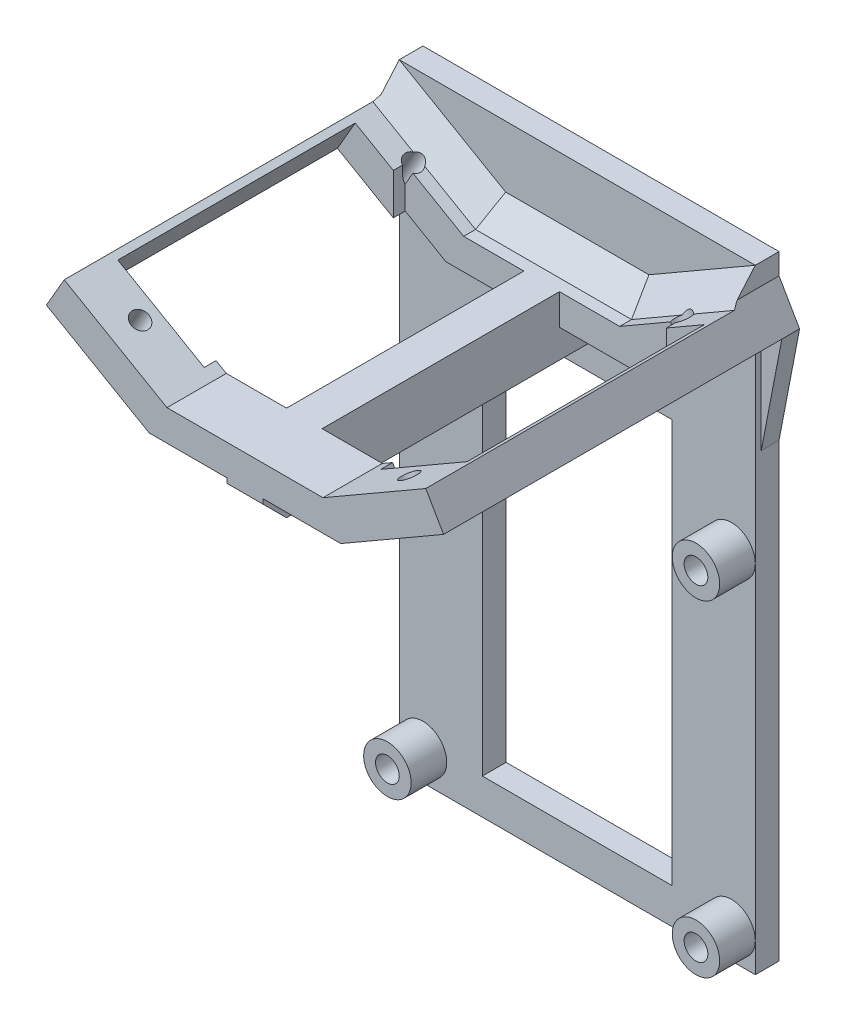
from build123d import *

# Parameters (mm, degrees)
EXTRUDE_1_DEPTH      = 2
EXTRUDE_2_DEPTH      = 28
EXTRUDE_2_DEPTH_BACK = 2
CUT_EXTRUDE_5_REACH  = 61.651
SKETCH_3_R           = 0.75
SKETCH_3_W           = 9
SKETCH_3_H           = 20
CUT_EXTRUDE_7_REACH  = 62.685
SKETCH_12_R          = 0.75
SKETCH_12_W          = 9
SKETCH_12_H          = 20
CUT_EXTRUDE_8_REACH  = 74.725
SKETCH_13_R          = 1
SKETCH_13_W          = 16
SKETCH_13_H          = 34
CHAMFER_5_SIZE       = 2
SKETCH_14_W          = 3
SKETCH_14_H          = 5
EXTRUDE_8_DEPTH      = 28
CHAMFER_6_SIZE       = 2
EXTRUDE_START        = 3
SKETCH_15_R          = 2
SKETCH_15_R_2        = 1
EXTRUDE_9_DEPTH      = 3
CUT_EXTRUDE_9_REACH  = 56.258
SKETCH_16_W          = 10
SKETCH_16_H          = 20
EXTRUDE_10_DEPTH     = 24
EXTRUDE_11_DEPTH     = 1.5
CUT_EXTRUDE_10_REACH = 74.725
SKETCH_19_W          = 30
SKETCH_19_H          = 13.226497308


with BuildPart() as part:
    # 草圖1 → 填料-伸長1 (new body)
    with BuildSketch(Plane.XY):
        Polygon((-15, 0), (15, 0), (15, -15), (16.732050808, -18), (15, -19), (15, -65), (-15, -65), (-15, -19), (-16.732050808, -18), (-15, -15), align=None)
    extrude(amount=EXTRUDE_1_DEPTH)

    # 草圖2 → 填料-伸長2 (add, two sides: drawn at the far end of the back side and taken through both)
    with BuildSketch(Plane.XY.offset(2).offset(-EXTRUDE_2_DEPTH_BACK)):
        Polygon((-16.732050808, -18), (-8.07179677, -23), (8.07179677, -23), (16.732050808, -18), (15.232050808, -15.401923789), (6.57179677, -20.401923789), (-6.57179677, -20.401923789), (-15.232050808, -15.401923789), align=None)
    extrude(amount=EXTRUDE_2_DEPTH + EXTRUDE_2_DEPTH_BACK)

    # 草圖3 → 除料-伸長5 (cut, up to next)
    with BuildSketch(Plane(origin=(10.813121216, -21.417295593, 0), x_dir=(0.8660254037844397, 0.49999999999999806, 0), z_dir=(-0.49999999999999806, 0.8660254037844397, 0)), mode=Mode.PRIVATE) as cut_extrude_5_sk1:
        with Locations(Location((2.334591186, -4.5, 0), (0, 0, 180))):
            Circle(SKETCH_3_R)
    cut_extrude_5_tool1 = extrude(cut_extrude_5_sk1.sketch, amount=CUT_EXTRUDE_5_REACH, mode=Mode.PRIVATE) & part.part
    # 草圖3 → 除料-伸長5 (cut, up to next)
    with BuildSketch(Plane(origin=(10.813121216, -21.417295593, 0), x_dir=(0.8660254037844397, 0.49999999999999806, 0), z_dir=(-0.49999999999999806, 0.8660254037844397, 0)), mode=Mode.PRIVATE) as cut_extrude_5_sk2:
        with Locations(Location((2.334591186, -27.5, 0), (0, 0, 180))):
            Circle(SKETCH_3_R)
    cut_extrude_5_tool2 = extrude(cut_extrude_5_sk2.sketch, amount=CUT_EXTRUDE_5_REACH, mode=Mode.PRIVATE) & part.part
    # 草圖3 → 除料-伸長5 (cut, up to next)
    with BuildSketch(Plane(origin=(10.813121216, -21.417295593, 0), x_dir=(0.8660254037844397, 0.49999999999999806, 0), z_dir=(-0.49999999999999806, 0.8660254037844397, 0)), mode=Mode.PRIVATE) as cut_extrude_5_sk3:
        with Locations((2.334591186, -16)):
            Rectangle(SKETCH_3_W, SKETCH_3_H)
    cut_extrude_5_tool3 = extrude(cut_extrude_5_sk3.sketch, amount=CUT_EXTRUDE_5_REACH, mode=Mode.PRIVATE) & part.part
    add(cut_extrude_5_tool1.solids().sort_by_distance((12.834936, -20.25, 4.5))[0], mode=Mode.SUBTRACT)
    add(cut_extrude_5_tool2.solids().sort_by_distance((12.834936, -20.25, 27.5))[0], mode=Mode.SUBTRACT)
    add(cut_extrude_5_tool3.solids().sort_by_distance((12.834936, -20.25, 16))[0], mode=Mode.SUBTRACT)

    # 草圖12 → 除料-伸長7 (cut, up to next)
    with BuildSketch(Plane(origin=(-11.977241336, -20.745190528, 0), x_dir=(0.8660254037844368, -0.5000000000000032, 0), z_dir=(-0.5000000000000032, -0.8660254037844369, 0)), mode=Mode.PRIVATE) as cut_extrude_7_sk1:
        with Locations((-0.990381057, 27.5)):
            Circle(SKETCH_12_R)
    cut_extrude_7_tool1 = extrude(cut_extrude_7_sk1.sketch, amount=-CUT_EXTRUDE_7_REACH, mode=Mode.PRIVATE) & part.part
    # 草圖12 → 除料-伸長7 (cut, up to next)
    with BuildSketch(Plane(origin=(-11.977241336, -20.745190528, 0), x_dir=(0.8660254037844368, -0.5000000000000032, 0), z_dir=(-0.5000000000000032, -0.8660254037844369, 0)), mode=Mode.PRIVATE) as cut_extrude_7_sk2:
        with Locations((-0.990381057, 4.5)):
            Circle(SKETCH_12_R)
    cut_extrude_7_tool2 = extrude(cut_extrude_7_sk2.sketch, amount=-CUT_EXTRUDE_7_REACH, mode=Mode.PRIVATE) & part.part
    # 草圖12 → 除料-伸長7 (cut, up to next)
    with BuildSketch(Plane(origin=(-11.977241336, -20.745190528, 0), x_dir=(0.8660254037844368, -0.5000000000000032, 0), z_dir=(-0.5000000000000032, -0.8660254037844369, 0)), mode=Mode.PRIVATE) as cut_extrude_7_sk3:
        with Locations((-0.990381057, 16)):
            Rectangle(SKETCH_12_W, SKETCH_12_H)
    cut_extrude_7_tool3 = extrude(cut_extrude_7_sk3.sketch, amount=-CUT_EXTRUDE_7_REACH, mode=Mode.PRIVATE) & part.part
    add(cut_extrude_7_tool1.solids().sort_by_distance((-12.834936, -20.25, 27.5))[0], mode=Mode.SUBTRACT)
    add(cut_extrude_7_tool2.solids().sort_by_distance((-12.834936, -20.25, 4.5))[0], mode=Mode.SUBTRACT)
    add(cut_extrude_7_tool3.solids().sort_by_distance((-12.834936, -20.25, 16))[0], mode=Mode.SUBTRACT)

    # 草圖13 → 除料-伸長8 (cut, up to next)
    with BuildSketch(Plane.XY.offset(2), mode=Mode.PRIVATE) as cut_extrude_8_sk1:
        with Locations((-13, -35)):
            Circle(SKETCH_13_R)
    cut_extrude_8_tool1 = extrude(cut_extrude_8_sk1.sketch, amount=-CUT_EXTRUDE_8_REACH, mode=Mode.PRIVATE) & part.part
    # 草圖13 → 除料-伸長8 (cut, up to next)
    with BuildSketch(Plane.XY.offset(2), mode=Mode.PRIVATE) as cut_extrude_8_sk2:
        with Locations((13, -35)):
            Circle(SKETCH_13_R)
    cut_extrude_8_tool2 = extrude(cut_extrude_8_sk2.sketch, amount=-CUT_EXTRUDE_8_REACH, mode=Mode.PRIVATE) & part.part
    # 草圖13 → 除料-伸長8 (cut, up to next)
    with BuildSketch(Plane.XY.offset(2), mode=Mode.PRIVATE) as cut_extrude_8_sk3:
        with Locations((-13, -62.5)):
            Circle(SKETCH_13_R)
    cut_extrude_8_tool3 = extrude(cut_extrude_8_sk3.sketch, amount=-CUT_EXTRUDE_8_REACH, mode=Mode.PRIVATE) & part.part
    # 草圖13 → 除料-伸長8 (cut, up to next)
    with BuildSketch(Plane.XY.offset(2), mode=Mode.PRIVATE) as cut_extrude_8_sk4:
        with Locations((13, -62.5)):
            Circle(SKETCH_13_R)
    cut_extrude_8_tool4 = extrude(cut_extrude_8_sk4.sketch, amount=-CUT_EXTRUDE_8_REACH, mode=Mode.PRIVATE) & part.part
    # 草圖13 → 除料-伸長8 (cut, up to next)
    with BuildSketch(Plane.XY.offset(2), mode=Mode.PRIVATE) as cut_extrude_8_sk5:
        with Locations((0, -45)):
            Rectangle(SKETCH_13_W, SKETCH_13_H)
    cut_extrude_8_tool5 = extrude(cut_extrude_8_sk5.sketch, amount=-CUT_EXTRUDE_8_REACH, mode=Mode.PRIVATE) & part.part
    add(cut_extrude_8_tool1.solids().sort_by_distance((-13, -35, 2))[0], mode=Mode.SUBTRACT)
    add(cut_extrude_8_tool2.solids().sort_by_distance((13, -35, 2))[0], mode=Mode.SUBTRACT)
    add(cut_extrude_8_tool3.solids().sort_by_distance((-13, -62.5, 2))[0], mode=Mode.SUBTRACT)
    add(cut_extrude_8_tool4.solids().sort_by_distance((13, -62.5, 2))[0], mode=Mode.SUBTRACT)
    add(cut_extrude_8_tool5.solids().sort_by_distance((0, -45, 2))[0], mode=Mode.SUBTRACT)

    # 導角5
    # the kernel refuses this chamfer: 2 mm, written as the material it adds along each edge
    with BuildSketch(Plane(origin=(15.232050808, -15.401923789, 2), x_dir=(-0.4998109584556485, 0.8656979742248804, -0.027495876610586403), z_dir=(-0.8660254037844387, -0.5000000000000001, 0))) as chamfer_5_piece_1_section:
        Polygon((CHAMFER_5_SIZE * 0.999621916911, -CHAMFER_5_SIZE * 0.0274958766106), (-CHAMFER_5_SIZE * 0.0274958766106, -CHAMFER_5_SIZE * 0.999621916911), (0, 0), align=None)
    chamfer_5_piece_1 = extrude(amount=15.143365976, mode=Mode.PRIVATE)
    chamfer_5_piece_1 = split(chamfer_5_piece_1, bisect_by=Plane(origin=(15, -15.354369678, 2.967720973), z_dir=(1, 0, 0)), keep=Keep.TOP, mode=Mode.PRIVATE)
    add(chamfer_5_piece_1)
    with BuildSketch(Plane(origin=(19.686336404, -12.830240801, 2), x_dir=(-0.4998109584556485, 0.8656979742248805, -0.027495876610586424), z_dir=(-0.8660254037844387, -0.5000000000000001, 0))) as chamfer_5_piece_2_section:
        Polygon((CHAMFER_5_SIZE * 0.999621916911, -CHAMFER_5_SIZE * 0.0274958766106), (-CHAMFER_5_SIZE * 0.0274958766106, -CHAMFER_5_SIZE * 0.999621916911), (0, 0), align=None)
    chamfer_5_piece_2 = extrude(amount=20.286731952, mode=Mode.PRIVATE)
    chamfer_5_piece_2 = split(chamfer_5_piece_2, bisect_by=Plane(origin=(15, -14.178978025, 2.335634482), z_dir=(-1, 0, 0)), keep=Keep.TOP, mode=Mode.PRIVATE)
    chamfer_5_piece_2 = split(chamfer_5_piece_2, bisect_by=Plane(origin=(14.593699493, -14.296266878, 2.335634482), z_dir=(0.8660254037844362, 0.5000000000000043, 0)), keep=Keep.TOP, mode=Mode.PRIVATE)
    add(chamfer_5_piece_2)
    with BuildSketch(Plane(origin=(15.232050808, -15.401923789, 2), x_dir=(-0.4998109584556485, 0.8656979742248804, -0.027495876610586403), z_dir=(-0.8660254037844387, -0.5000000000000001, 0))) as chamfer_5_piece_3_section:
        Polygon((CHAMFER_5_SIZE * 0.999621916911, -CHAMFER_5_SIZE * 0.0274958766106), (-CHAMFER_5_SIZE * 0.0274958766106, -CHAMFER_5_SIZE * 0.999621916911), (0, 0), align=None)
    chamfer_5_piece_3 = extrude(amount=15.143365976, mode=Mode.PRIVATE)
    chamfer_5_piece_3 = split(chamfer_5_piece_3, bisect_by=Plane(origin=(15, -17.612583445, 2.634430094), z_dir=(-1, 0, 0)), keep=Keep.TOP, mode=Mode.PRIVATE)
    chamfer_5_piece_3 = split(chamfer_5_piece_3, bisect_by=Plane(origin=(9.995642462, -20.401923789, 2.634430094), z_dir=(0, 1, 0)), keep=Keep.TOP, mode=Mode.PRIVATE)
    chamfer_5_piece_3 = chamfer_5_piece_3 - Plane(origin=(10.983078115, -17.042487205, 4.5), x_dir=(-0.8660254037844397, -0.49999999999999806, 0), z_dir=(0.49999999999999806, -0.8660254037844397, 0)) * Cylinder(0.75, 39, mode=Mode.PRIVATE)
    add(chamfer_5_piece_3)
    with BuildSketch(Plane(origin=(15.232050808, -15.401923789, 2), x_dir=(-0.4998109584556485, 0.8656979742248804, -0.027495876610586403), z_dir=(-0.8660254037844387, -0.5000000000000001, 0))) as chamfer_5_piece_4_section:
        Polygon((CHAMFER_5_SIZE * 0.999621916911, -CHAMFER_5_SIZE * 0.0274958766106), (-CHAMFER_5_SIZE * 0.0274958766106, -CHAMFER_5_SIZE * 0.999621916911), (0, 0), align=None)
    chamfer_5_piece_4 = extrude(amount=15.143365976, mode=Mode.PRIVATE)
    chamfer_5_piece_4 = split(chamfer_5_piece_4, bisect_by=Plane(origin=(3.657625077, -20.401923789, 2.718374554), z_dir=(0, -1, 0)), keep=Keep.TOP, mode=Mode.PRIVATE)
    add(chamfer_5_piece_4)
    with BuildSketch(Plane(origin=(11.715162746, -20.401923789, 2), x_dir=(0, 0.9996219169112968, -0.027495876610586403), z_dir=(-1, 0, 0))) as chamfer_5_piece_5:
        Polygon((CHAMFER_5_SIZE * 0.999621916911, -CHAMFER_5_SIZE * 0.0274958766106), (-CHAMFER_5_SIZE * 0.0274958766106, -CHAMFER_5_SIZE * 0.999621916911), (0, 0), align=None)
    extrude(amount=23.430325491)
    with BuildSketch(Plane(origin=(-2.117511174, -22.973606777, 2), x_dir=(0.4998109584556478, 0.8656979742248807, -0.027495876610586365), z_dir=(-0.866025403784439, 0.4999999999999994, 0))) as chamfer_5_piece_6_section:
        Polygon((CHAMFER_5_SIZE * 0.999621916911, -CHAMFER_5_SIZE * 0.0274958766106), (-CHAMFER_5_SIZE * 0.0274958766106, -CHAMFER_5_SIZE * 0.999621916911), (0, 0), align=None)
    chamfer_5_piece_6 = extrude(amount=15.143365976, mode=Mode.PRIVATE)
    chamfer_5_piece_6 = split(chamfer_5_piece_6, bisect_by=Plane(origin=(-3.657625077, -20.401923789, 2.718374554), z_dir=(0, -1, 0)), keep=Keep.TOP, mode=Mode.PRIVATE)
    add(chamfer_5_piece_6)
    with BuildSketch(Plane(origin=(-2.117511174, -22.973606777, 2), x_dir=(0.4998109584556478, 0.8656979742248807, -0.027495876610586365), z_dir=(-0.866025403784439, 0.4999999999999994, 0))) as chamfer_5_piece_7_section:
        Polygon((CHAMFER_5_SIZE * 0.999621916911, -CHAMFER_5_SIZE * 0.0274958766106), (-CHAMFER_5_SIZE * 0.0274958766106, -CHAMFER_5_SIZE * 0.999621916911), (0, 0), align=None)
    chamfer_5_piece_7 = extrude(amount=15.143365976, mode=Mode.PRIVATE)
    chamfer_5_piece_7 = split(chamfer_5_piece_7, bisect_by=Plane(origin=(-15, -17.612583445, 2.634430094), z_dir=(1, 0, 0)), keep=Keep.TOP, mode=Mode.PRIVATE)
    chamfer_5_piece_7 = split(chamfer_5_piece_7, bisect_by=Plane(origin=(-9.995642462, -20.401923789, 2.634430094), z_dir=(0, 1, 0)), keep=Keep.TOP, mode=Mode.PRIVATE)
    chamfer_5_piece_7 = chamfer_5_piece_7 - Plane(origin=(-10.983078115, -17.042487205, 4.5), x_dir=(0.8660254037844369, -0.5000000000000032, 0), z_dir=(-0.5000000000000032, -0.8660254037844369, 0)) * Cylinder(0.75, 39, mode=Mode.PRIVATE)
    add(chamfer_5_piece_7)
    with BuildSketch(Plane(origin=(-2.117511174, -22.973606777, 2), x_dir=(0.4998109584556478, 0.8656979742248807, -0.027495876610586365), z_dir=(-0.866025403784439, 0.4999999999999994, 0))) as chamfer_5_piece_8_section:
        Polygon((CHAMFER_5_SIZE * 0.999621916911, -CHAMFER_5_SIZE * 0.0274958766106), (-CHAMFER_5_SIZE * 0.0274958766106, -CHAMFER_5_SIZE * 0.999621916911), (0, 0), align=None)
    chamfer_5_piece_8 = extrude(amount=15.143365976, mode=Mode.PRIVATE)
    chamfer_5_piece_8 = split(chamfer_5_piece_8, bisect_by=Plane(origin=(-15, -15.354369678, 2.967720973), z_dir=(-1, 0, 0)), keep=Keep.TOP, mode=Mode.PRIVATE)
    add(chamfer_5_piece_8)
    with BuildSketch(Plane(origin=(-2.117511174, -22.973606777, 2), x_dir=(0.4998109584556478, 0.8656979742248807, -0.027495876610586365), z_dir=(-0.866025403784439, 0.4999999999999994, 0))) as chamfer_5_piece_9_section:
        Polygon((CHAMFER_5_SIZE * 0.999621916911, -CHAMFER_5_SIZE * 0.0274958766106), (-CHAMFER_5_SIZE * 0.0274958766106, -CHAMFER_5_SIZE * 0.999621916911), (0, 0), align=None)
    chamfer_5_piece_9 = extrude(amount=20.286731952, mode=Mode.PRIVATE)
    chamfer_5_piece_9 = split(chamfer_5_piece_9, bisect_by=Plane(origin=(-15, -14.178978025, 2.335634482), z_dir=(1, 0, 0)), keep=Keep.TOP, mode=Mode.PRIVATE)
    chamfer_5_piece_9 = split(chamfer_5_piece_9, bisect_by=Plane(origin=(-14.593699493, -14.296266878, 2.335634482), z_dir=(-0.8660254037844384, 0.5000000000000004, 0)), keep=Keep.TOP, mode=Mode.PRIVATE)
    add(chamfer_5_piece_9)

    # 草圖14 → 填料-伸長8 (add)
    with BuildSketch(Plane.XY.offset(30)):
        with Locations((0, -22.901923789)):
            Rectangle(SKETCH_14_W, SKETCH_14_H)
    extrude(amount=-EXTRUDE_8_DEPTH)

    # 導角6
    chamfer_6_edges = [part.edges().sort_by_distance(p)[0] for p in [
        (0, -25.401923789, 30),
    ]]
    chamfer(chamfer_6_edges, length=CHAMFER_6_SIZE)

    # 草圖15 → 填料-伸長9 (add)
    # profile 1 of 4: a face of its own
    with BuildSketch(Plane.XY.offset(2).offset(EXTRUDE_START)):
        with Locations(Location((-13, -35, 0), (0, 0, 180))):
            Circle(SKETCH_15_R)
        with Locations((-13, -35)):
            Circle(SKETCH_15_R_2, mode=Mode.SUBTRACT)
    # profile 2 of 4: a face of its own
    with BuildSketch(Plane.XY.offset(2).offset(EXTRUDE_START)):
        with Locations((13, -35)):
            Circle(SKETCH_15_R)
        with Locations((13, -35)):
            Circle(SKETCH_15_R_2, mode=Mode.SUBTRACT)
    # profile 3 of 4: a face of its own
    with BuildSketch(Plane.XY.offset(2).offset(EXTRUDE_START)):
        with Locations((13, -62.5)):
            Circle(SKETCH_15_R)
        with Locations((13, -62.5)):
            Circle(SKETCH_15_R_2, mode=Mode.SUBTRACT)
    # profile 4 of 4: a face of its own
    with BuildSketch(Plane.XY.offset(2).offset(EXTRUDE_START)):
        with Locations(Location((-13, -62.5, 0), (0, 0, 180))):
            Circle(SKETCH_15_R)
        with Locations((-13, -62.5)):
            Circle(SKETCH_15_R_2, mode=Mode.SUBTRACT)
    extrude(amount=-EXTRUDE_9_DEPTH)

    # 草圖16 → 除料-伸長9 (cut, up to next)
    with BuildSketch(Plane.XZ.offset(23), mode=Mode.PRIVATE) as cut_extrude_9_sk1:
        with Locations((-6.5, 15)):
            Rectangle(SKETCH_16_W, SKETCH_16_H)
    cut_extrude_9_tool1 = extrude(cut_extrude_9_sk1.sketch, amount=-CUT_EXTRUDE_9_REACH, mode=Mode.PRIVATE) & part.part
    # 草圖16 → 除料-伸長9 (cut, up to next)
    with BuildSketch(Plane.XZ.offset(23), mode=Mode.PRIVATE) as cut_extrude_9_sk2:
        with Locations((6.5, 15)):
            Rectangle(SKETCH_16_W, SKETCH_16_H)
    cut_extrude_9_tool2 = extrude(cut_extrude_9_sk2.sketch, amount=-CUT_EXTRUDE_9_REACH, mode=Mode.PRIVATE) & part.part
    add(cut_extrude_9_tool1.solids().sort_by_distance((-6.5, -23, 15))[0], mode=Mode.SUBTRACT)
    add(cut_extrude_9_tool2.solids().sort_by_distance((6.5, -23, 15))[0], mode=Mode.SUBTRACT)

    # 草圖17 → 填料-伸長10 (add)
    with BuildSketch(Plane.XY.offset(30)):
        Polygon((-15.232050808, -15.401923789), (-16.732050808, -18), (-16.212435565, -18.3), (-14.712435565, -15.701923789), align=None)
        Polygon((15.232050808, -15.401923789), (16.732050808, -18), (16.212435565, -18.3), (14.712435565, -15.701923789), align=None)
    extrude(amount=-EXTRUDE_10_DEPTH)

    # 草圖18 → 填料-伸長11 (add)
    with BuildSketch(Plane(origin=(0, 0, 0), x_dir=(-1, 0, 0), z_dir=(0, 0, -1))):
        Polygon((-16.732050808, -18), (-15, -27), (-15, -19), align=None)
        Polygon((16.732050808, -18), (15, -19), (15, -27), align=None)
    extrude(amount=-EXTRUDE_11_DEPTH)

    # 草圖19 → 除料-伸長10 (cut, up to next)
    with BuildSketch(Plane.XY.offset(2), mode=Mode.PRIVATE) as cut_extrude_10_sk1:
        with Locations((0, -6.613248654)):
            Rectangle(SKETCH_19_W, SKETCH_19_H)
    cut_extrude_10_tool1 = extrude(cut_extrude_10_sk1.sketch, amount=-CUT_EXTRUDE_10_REACH, mode=Mode.PRIVATE) & part.part
    add(cut_extrude_10_tool1.solids().sort_by_distance((0, -6.613249, 2))[0], mode=Mode.SUBTRACT)


solid = part.part
